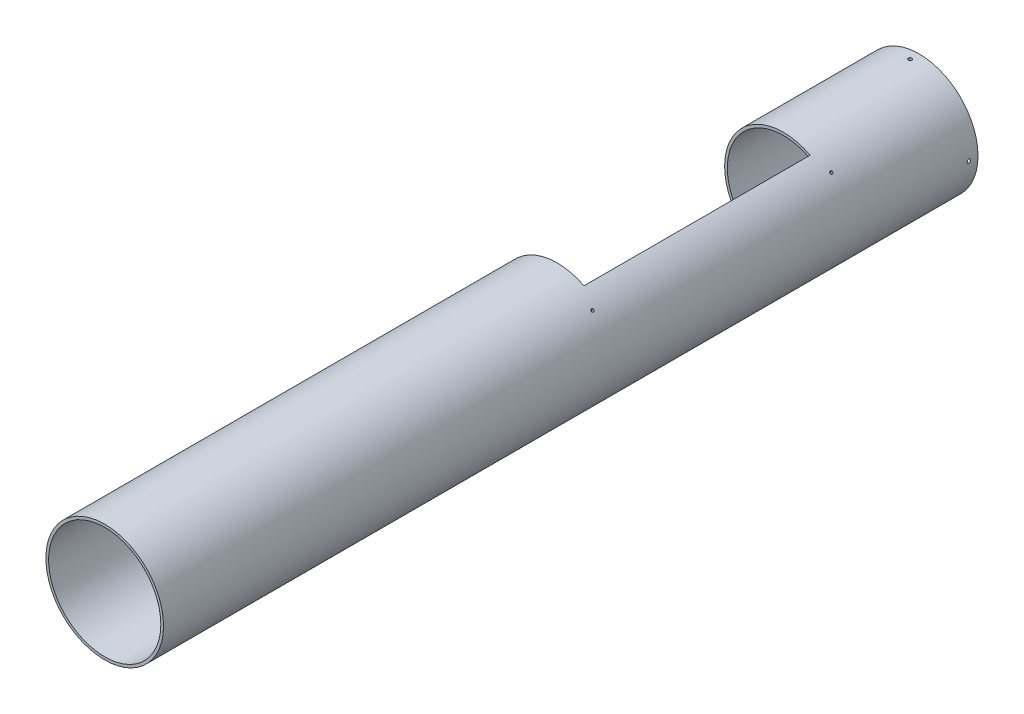
from build123d import *

# Parameters (mm, degrees)
SKETCH1_R           = 65
SKETCH1_R_2         = 62
BOSS_EXTRUDE1_DEPTH = 900
SKETCH4_W           = 130
SKETCH4_H           = 250
CUT_EXTRUDE4_DEPTH  = 516
SKETCH5_R           = 2
CUT_EXTRUDE5_DEPTH  = 85
CIRPATTERN1_COUNT   = 4
SKETCH7_R           = 1.5
CUT_EXTRUDE6_DEPTH  = 243
CIRPATTERN2_COUNT   = 4


with BuildPart() as part:
    # Sketch1 → Boss-Extrude1 (new body)
    with BuildSketch(Plane.XY):
        Circle(SKETCH1_R)
        Circle(SKETCH1_R_2, mode=Mode.SUBTRACT)
    extrude(amount=BOSS_EXTRUDE1_DEPTH)

    # Sketch4 → Cut-Extrude4 (cut)
    with BuildSketch(Plane(origin=(-14.142135624, 14.142135624, 0), x_dir=(0.7071067811865477, 0.7071067811865475, 0), z_dir=(-0.7071067811865475, 0.7071067811865477, 0))):
        with Locations((0, -275)):
            Rectangle(SKETCH4_W, SKETCH4_H)
    extrude(amount=CUT_EXTRUDE4_DEPTH, mode=Mode.SUBTRACT)

    # Sketch5 → Cut-Extrude5 (cut)
    with BuildSketch(Plane(origin=(0, 0, 0), x_dir=(1, 0, 0), z_dir=(0, 1, 0))):
        with Locations((0, -10)):
            Circle(SKETCH5_R)
    cut_extrude5 = extrude(amount=-CUT_EXTRUDE5_DEPTH, mode=Mode.SUBTRACT)

    # CirPattern1: Cut-Extrude5 ×4 about axis
    cirpattern1_axis = Axis((0, 0, 900), (0, 0, -1))
    for i in range(1, CIRPATTERN1_COUNT):
        add(cut_extrude5.rotate(cirpattern1_axis, i * 360 / CIRPATTERN1_COUNT), mode=Mode.SUBTRACT)

    # Sketch7 → Cut-Extrude6 (cut)
    with BuildSketch(Plane(origin=(-14.142135624, 14.142135624, 0), x_dir=(0.7071067811865477, 0.7071067811865475, 0), z_dir=(-0.7071067811865475, 0.7071067811865477, 0))):
        with Locations((0, -143)):
            Circle(SKETCH7_R)
        with Locations((0, -407)):
            Circle(SKETCH7_R)
    cut_extrude6 = extrude(amount=CUT_EXTRUDE6_DEPTH, mode=Mode.SUBTRACT)

    # CirPattern2: Cut-Extrude6 ×4 about axis
    cirpattern2_axis = Axis((0, 0, 900), (0, 0, -1))
    for i in range(1, CIRPATTERN2_COUNT):
        add(cut_extrude6.rotate(cirpattern2_axis, i * 360 / CIRPATTERN2_COUNT), mode=Mode.SUBTRACT)


solid = part.part
